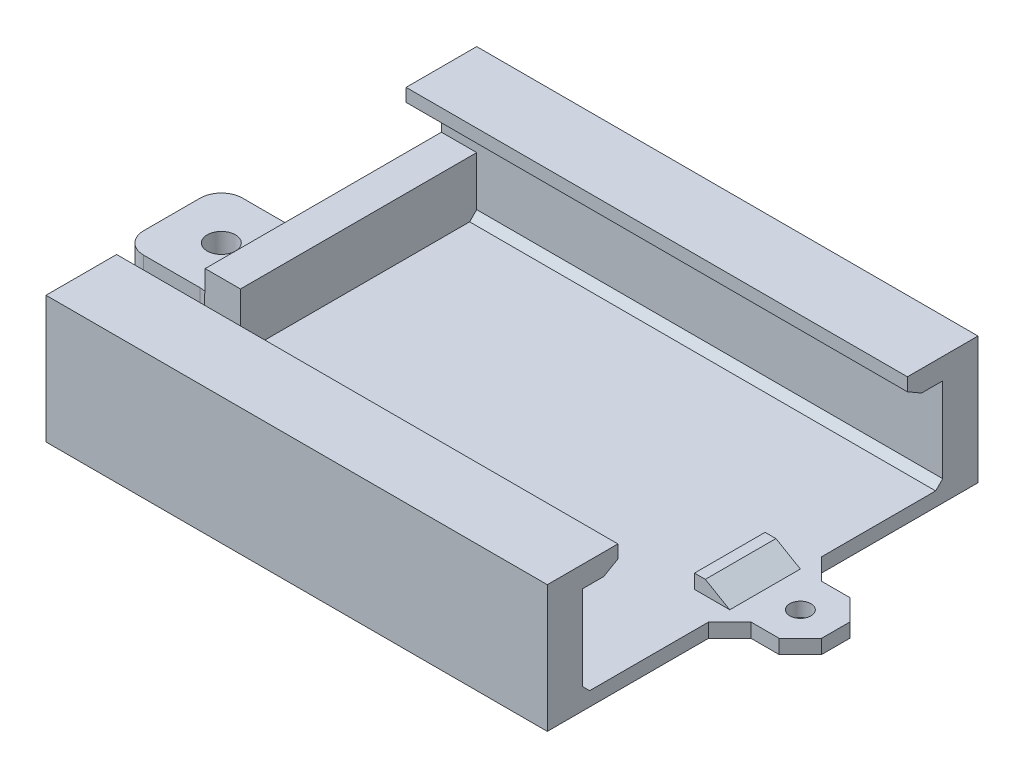
from build123d import *

# Parameters (mm, degrees)
SKETCH1_W           = 71
SKETCH1_H           = 61
SKETCH1_W_2         = 61
SKETCH1_H_2         = 51
BOSS_EXTRUDE1_DEPTH = 16
SKETCH2_W           = 71
SKETCH2_H           = 61
BOSS_EXTRUDE2_DEPTH = 2
SKETCH3_W           = 11.849749017
SKETCH3_H           = 16
CUT_EXTRUDE1_DEPTH  = 12
FILLET1_R           = 3
SKETCH4_W           = 15
SKETCH4_H           = 16
CUT_EXTRUDE2_DEPTH  = 12
SKETCH5_W           = 21
SKETCH5_H           = 8
CUT_EXTRUDE3_DEPTH  = 12
SKETCH6_W           = 51
SKETCH6_H           = 8
CUT_EXTRUDE4_DEPTH  = 12
CHAMFER1_SIZE       = 1
SKETCH8_W           = 21
SKETCH8_H           = 8
CUT_EXTRUDE5_DEPTH  = 14
SKETCH9_W           = 71
SKETCH9_H           = 3
BOSS_EXTRUDE4_DEPTH = 5
CHAMFER3_SIZE       = 2
CHAMFER3_SIZE2      = 1.154700538
SKETCH10_W          = 71
SKETCH10_H          = 3
BOSS_EXTRUDE5_DEPTH = 5
CHAMFER4_SIZE       = 2
CHAMFER4_SIZE2      = 1.154700538
SKETCH11_W          = 5
SKETCH11_H          = 10
BOSS_EXTRUDE6_DEPTH = 2
CHAMFER5_SIZE       = 2
CHAMFER5_SIZE2      = 3.464101615
SKETCH12_W          = 14
SKETCH12_H          = 5
BOSS_EXTRUDE7_DEPTH = 14
CHAMFER6_SIZE       = 2
SKETCH13_R          = 2
CUT_EXTRUDE6_DEPTH  = 14
FILLET2_R           = 3
SKETCH14_W          = 10
SKETCH14_H          = 2
BOSS_EXTRUDE8_DEPTH = 10
SKETCH15_R          = 1.5
CUT_EXTRUDE7_DEPTH  = 10
CHAMFER7_SIZE       = 3
CHAMFER8_SIZE       = 3
FILLET3_R           = 3


with BuildPart() as part:
    # Sketch1 → Boss-Extrude1 (new body)
    with BuildSketch(Plane(origin=(0, 0, 0), x_dir=(1, 0, 0), z_dir=(0, 1, 0))):
        Rectangle(SKETCH1_W, SKETCH1_H)
        Rectangle(SKETCH1_W_2, SKETCH1_H_2, mode=Mode.SUBTRACT)
    extrude(amount=BOSS_EXTRUDE1_DEPTH)

    # Sketch2 → Boss-Extrude2 (add)
    with BuildSketch(Plane.XZ):
        Rectangle(SKETCH2_W, SKETCH2_H)
    extrude(amount=BOSS_EXTRUDE2_DEPTH)

    # Sketch3 → Cut-Extrude1 (cut)
    with BuildSketch(Plane(origin=(-30.5, 0, 0), x_dir=(0, 0, -1), z_dir=(1, 0, 0))):
        with Locations((-13.884589143, 8)):
            Rectangle(SKETCH3_W, SKETCH3_H)
    extrude(amount=-CUT_EXTRUDE1_DEPTH, mode=Mode.SUBTRACT)

    # Fillet1
    fillet1_edges = [part.edges().sort_by_distance(p)[0] for p in [
        (-33, 0, 19.809463651),
        (-33, 0, 7.959714634),
    ]]
    fillet(fillet1_edges, radius=FILLET1_R)

    # Sketch4 → Cut-Extrude2 (cut)
    with BuildSketch(Plane.ZY.offset(-30.5)):
        with Locations((-18, 8)):
            Rectangle(SKETCH4_W, SKETCH4_H)
        with Locations((18, 8)):
            Rectangle(SKETCH4_W, SKETCH4_H)
    extrude(amount=-CUT_EXTRUDE2_DEPTH, mode=Mode.SUBTRACT)

    # Sketch5 → Cut-Extrude3 (cut)
    with BuildSketch(Plane.ZY.offset(-30.5)):
        with Locations((0, 12)):
            Rectangle(SKETCH5_W, SKETCH5_H)
    extrude(amount=-CUT_EXTRUDE3_DEPTH, mode=Mode.SUBTRACT)

    # Sketch6 → Cut-Extrude4 (cut)
    with BuildSketch(Plane(origin=(-30.5, 0, 0), x_dir=(0, 0, -1), z_dir=(1, 0, 0))):
        with Locations((0, 12)):
            Rectangle(SKETCH6_W, SKETCH6_H)
    extrude(amount=-CUT_EXTRUDE4_DEPTH, mode=Mode.SUBTRACT)

    # Chamfer1
    chamfer1_edges = [part.edges().sort_by_distance(p)[0] for p in [
        (2.5, 0, -25.5),
        (2.5, 0, 25.5),
    ]]
    chamfer(chamfer1_edges, length=CHAMFER1_SIZE)

    # Sketch8 → Cut-Extrude5 (cut)
    with BuildSketch(Plane.ZY.offset(-30.5)):
        with Locations((0, 4)):
            Rectangle(SKETCH8_W, SKETCH8_H)
    extrude(amount=-CUT_EXTRUDE5_DEPTH, mode=Mode.SUBTRACT)

    # Sketch9 → Boss-Extrude4 (add)
    with BuildSketch(Plane.XY.offset(-25.5)):
        with Locations((0, 14.5)):
            Rectangle(SKETCH9_W, SKETCH9_H)
    extrude(amount=BOSS_EXTRUDE4_DEPTH)

    # Chamfer3
    chamfer3_edges = [part.edges().sort_by_distance(p)[0] for p in [
        (0, 13, -20.5),
    ]]
    chamfer3_side = [part.faces().sort_by_distance(p)[0] for p in [
        (0, 13, -23),
    ]]
    chamfer(chamfer3_edges, length=CHAMFER3_SIZE, length2=CHAMFER3_SIZE2, reference=chamfer3_side[0])

    # Sketch10 → Boss-Extrude5 (add)
    with BuildSketch(Plane(origin=(0, 0, 25.5), x_dir=(-1, 0, 0), z_dir=(0, 0, -1))):
        with Locations((0, 14.5)):
            Rectangle(SKETCH10_W, SKETCH10_H)
    extrude(amount=BOSS_EXTRUDE5_DEPTH)

    # Chamfer4
    chamfer4_edges = [part.edges().sort_by_distance(p)[0] for p in [
        (0, 13, 20.5),
    ]]
    chamfer4_side = [part.faces().sort_by_distance(p)[0] for p in [
        (0, 13, 23),
    ]]
    chamfer(chamfer4_edges, length=CHAMFER4_SIZE, length2=CHAMFER4_SIZE2, reference=chamfer4_side[0])

    # Sketch11 → Boss-Extrude6 (add)
    with BuildSketch(Plane(origin=(0, 0, 0), x_dir=(1, 0, 0), z_dir=(0, 1, 0))):
        with Locations((33, 0.342687242)):
            Rectangle(SKETCH11_W, SKETCH11_H)
    extrude(amount=BOSS_EXTRUDE6_DEPTH)

    # Chamfer5
    chamfer5_edges = [part.edges().sort_by_distance(p)[0] for p in [
        (35.5, 2, -0.342687242),
    ]]
    chamfer5_side = [part.faces().sort_by_distance(p)[0] for p in [
        (35.5, 15.077350269, 21.136003145),
    ]]
    chamfer(chamfer5_edges, length=CHAMFER5_SIZE, length2=CHAMFER5_SIZE2, reference=chamfer5_side[0])

    # Sketch12 → Boss-Extrude7 (add)
    with BuildSketch(Plane.ZY.offset(35.5)):
        with Locations((-1.332725664, 0.5)):
            Rectangle(SKETCH12_W, SKETCH12_H)
    extrude(amount=BOSS_EXTRUDE7_DEPTH)

    # Chamfer6
    chamfer6_edges = [part.edges().sort_by_distance(p)[0] for p in [
        (-35.5, 3, -1.332725664),
    ]]
    chamfer(chamfer6_edges, length=CHAMFER6_SIZE)

    # Sketch13 → Cut-Extrude6 (cut)
    with BuildSketch(Plane(origin=(0, 3, 0), x_dir=(1, 0, 0), z_dir=(0, 1, 0))):
        with Locations(Location((-42.5, 1.332725664, 0), (0, 0, 270))):
            Circle(SKETCH13_R)
    extrude(amount=-CUT_EXTRUDE6_DEPTH, mode=Mode.SUBTRACT)

    # Fillet2
    fillet2_edges = [part.edges().sort_by_distance(p)[0] for p in [
        (-49.5, 0.5, -8.332725664),
        (-49.5, 0.5, 5.667274336),
    ]]
    fillet(fillet2_edges, radius=FILLET2_R)

    # Sketch14 → Boss-Extrude8 (add)
    with BuildSketch(Plane(origin=(35.5, 0, 0), x_dir=(0, 0, -1), z_dir=(1, 0, 0))):
        with Locations((0.342687242, -1)):
            Rectangle(SKETCH14_W, SKETCH14_H)
    extrude(amount=BOSS_EXTRUDE8_DEPTH)

    # Sketch15 → Cut-Extrude7 (cut)
    with BuildSketch(Plane(origin=(0, 0, 0), x_dir=(1, 0, 0), z_dir=(0, 1, 0))):
        with Locations(Location((40.5, 0.342687242, 0), (0, 0, 270))):
            Circle(SKETCH15_R)
    extrude(amount=-CUT_EXTRUDE7_DEPTH, mode=Mode.SUBTRACT)

    # Chamfer7
    chamfer7_edges = [part.edges().sort_by_distance(p)[0] for p in [
        (45.5, -1, 4.657312758),
        (45.5, -1, -5.342687242),
    ]]
    chamfer(chamfer7_edges, length=CHAMFER7_SIZE)

    # Chamfer8
    # the kernel refuses this chamfer: 3 mm, written as the material it adds along each edge
    with BuildSketch(Plane(origin=(35.5, -2, 4.657312758), x_dir=(0.9996219169112968, 0, -0.02749587661058648), z_dir=(0, 1, 0)), Plane(origin=(35.5, 0, -5.342687242), x_dir=(0.9996219169112968, 0, 0.02749587661058648), z_dir=(0, -1, 0))) as chamfer8_piece_1:
        Polygon((CHAMFER8_SIZE * 0.999621916911, -CHAMFER8_SIZE * 0.0274958766106), (-CHAMFER8_SIZE * 0.0274958766106, -CHAMFER8_SIZE * 0.999621916911), (0, 0), align=None)
    extrude(amount=2)

    # Fillet3
    # the kernel refuses this fillet: 3 mm, written as the material it adds along each edge
    with BuildSketch(Plane(origin=(-35.5, 12.5, 5.667274336), x_dir=(0, 0, 1), z_dir=(0, -1, 0))) as fillet3_piece_1_section:
        with BuildLine():
            CenterArc((FILLET3_R, FILLET3_R), FILLET3_R, 180, 90)
            Line((0, FILLET3_R), (0, 0))
            Line((0, 0), (FILLET3_R, 0))
        make_face()
    fillet3_piece_1 = extrude(amount=14.5, mode=Mode.PRIVATE)
    fillet3_piece_1 = split(fillet3_piece_1, bisect_by=Plane(origin=(-37.935900015, 2.564099985, 5.657679593), z_dir=(-0.7071067811865477, 0.7071067811865475, 0)), keep=Keep.TOP, mode=Mode.PRIVATE)
    fillet3_piece_1 = split(fillet3_piece_1, bisect_by=Plane(origin=(-38.08120002, 3, 5.657679593), z_dir=(0, -1, 0)), keep=Keep.TOP, mode=Mode.PRIVATE)
    add(fillet3_piece_1)
    with BuildSketch(Plane(origin=(-35.5, 12.5, 5.667274336), x_dir=(0, 0, 1), z_dir=(0, -1, 0))) as fillet3_piece_2_section:
        with BuildLine():
            CenterArc((FILLET3_R, FILLET3_R), FILLET3_R, 180, 90)
            Line((0, FILLET3_R), (0, 0))
            Line((0, 0), (FILLET3_R, 0))
        make_face()
    fillet3_piece_2 = extrude(amount=14.5, mode=Mode.PRIVATE)
    fillet3_piece_2 = split(fillet3_piece_2, bisect_by=Plane(origin=(-36.308682262, 4.191317738, 6.44717053), z_dir=(0.7071067811865477, -0.7071067811865475, 0)), keep=Keep.TOP, mode=Mode.PRIVATE)
    fillet3_piece_2 = split(fillet3_piece_2, bisect_by=Plane(origin=(-35.911576349, 3.794211825, 7.959714634), z_dir=(0, 0, -1)), keep=Keep.TOP, mode=Mode.PRIVATE)
    fillet3_piece_2 = split(fillet3_piece_2, bisect_by=Plane(origin=(-35.911576349, 3, 6.44717053), z_dir=(0, 1, 0)), keep=Keep.TOP, mode=Mode.PRIVATE)
    add(fillet3_piece_2)
    with BuildSketch(Plane(origin=(-35.5, 12.5, 5.667274336), x_dir=(0, 0, 1), z_dir=(0, -1, 0))) as fillet3_piece_3_section:
        with BuildLine():
            CenterArc((FILLET3_R, FILLET3_R), FILLET3_R, 180, 90)
            Line((0, FILLET3_R), (0, 0))
            Line((0, 0), (FILLET3_R, 0))
        make_face()
    fillet3_piece_3 = extrude(amount=14.5, mode=Mode.PRIVATE)
    fillet3_piece_3 = split(fillet3_piece_3, bisect_by=Plane(origin=(-38.099888212, 2.400111788, 6.295666552), z_dir=(0.7071067811865477, -0.7071067811865475, 0)), keep=Keep.TOP, mode=Mode.PRIVATE)
    fillet3_piece_3 = split(fillet3_piece_3, bisect_by=Plane(origin=(-36.191024286, 0.491247862, 7.959714634), z_dir=(0, 0, -1)), keep=Keep.TOP, mode=Mode.PRIVATE)
    fillet3_piece_3 = split(fillet3_piece_3, bisect_by=Plane(origin=(-36.191024286, 3, 6.295666552), z_dir=(0, -1, 0)), keep=Keep.TOP, mode=Mode.PRIVATE)
    add(fillet3_piece_3)
    with BuildSketch(Plane(origin=(-35.5, 12.5, 5.667274336), x_dir=(0, 0, 1), z_dir=(0, -1, 0))) as fillet3_piece_4_section:
        with BuildLine():
            CenterArc((FILLET3_R, FILLET3_R), FILLET3_R, 180, 90)
            Line((0, FILLET3_R), (0, 0))
            Line((0, 0), (FILLET3_R, 0))
        make_face()
    fillet3_piece_4 = extrude(amount=14.5, mode=Mode.PRIVATE)
    fillet3_piece_4 = split(fillet3_piece_4, bisect_by=Plane(origin=(-35.48926289, -0.06844391, 7.959714634), z_dir=(0, 0, 1)), keep=Keep.TOP, mode=Mode.PRIVATE)
    fillet3_piece_4 = fillet3_piece_4 - Plane(origin=(-35.48926289, 3, 10.959714634), x_dir=(0, -1, 0), z_dir=(-1, 0, 0)) * Cylinder(3, 41, mode=Mode.PRIVATE)
    fillet3_piece_4 = split(fillet3_piece_4, bisect_by=Plane(origin=(-35.48926289, 3, 8.232443119), z_dir=(0, -1, 0)), keep=Keep.TOP, mode=Mode.PRIVATE)
    add(fillet3_piece_4)
    with BuildSketch(Plane(origin=(-35.5, -2, -8.332725664), x_dir=(0, 0, -1), z_dir=(0, 1, 0))) as fillet3_piece_5_section:
        with BuildLine():
            CenterArc((FILLET3_R, FILLET3_R), FILLET3_R, 180, 90)
            Line((0, FILLET3_R), (0, 0))
            Line((0, 0), (FILLET3_R, 0))
        make_face()
    fillet3_piece_5 = extrude(amount=14.5, mode=Mode.PRIVATE)
    fillet3_piece_5 = split(fillet3_piece_5, bisect_by=Plane(origin=(-38.090184906, 2.409815094, -9.014565132), z_dir=(0.7071067811865477, -0.7071067811865475, 0)), keep=Keep.TOP, mode=Mode.PRIVATE)
    fillet3_piece_5 = split(fillet3_piece_5, bisect_by=Plane(origin=(-36.171856175, 3, -9.014565132), z_dir=(0, -1, 0)), keep=Keep.TOP, mode=Mode.PRIVATE)
    add(fillet3_piece_5)
    with BuildSketch(Plane(origin=(-35.5, -2, -8.332725664), x_dir=(0, 0, -1), z_dir=(0, 1, 0))) as fillet3_piece_6_section:
        with BuildLine():
            CenterArc((FILLET3_R, FILLET3_R), FILLET3_R, 180, 90)
            Line((0, FILLET3_R), (0, 0))
            Line((0, 0), (FILLET3_R, 0))
        make_face()
    fillet3_piece_6 = extrude(amount=14.5, mode=Mode.PRIVATE)
    fillet3_piece_6 = split(fillet3_piece_6, bisect_by=Plane(origin=(-37.935900015, 2.564099985, -8.32313092), z_dir=(-0.7071067811865477, 0.7071067811865475, 0)), keep=Keep.TOP, mode=Mode.PRIVATE)
    fillet3_piece_6 = split(fillet3_piece_6, bisect_by=Plane(origin=(-38.08120002, 3, -8.32313092), z_dir=(0, -1, 0)), keep=Keep.TOP, mode=Mode.PRIVATE)
    add(fillet3_piece_6)
    with BuildSketch(Plane(origin=(-35.5, -2, -8.332725664), x_dir=(0, 0, -1), z_dir=(0, 1, 0))) as fillet3_piece_7_section:
        with BuildLine():
            CenterArc((FILLET3_R, FILLET3_R), FILLET3_R, 180, 90)
            Line((0, FILLET3_R), (0, 0))
            Line((0, 0), (FILLET3_R, 0))
        make_face()
    fillet3_piece_7 = extrude(amount=14.5, mode=Mode.PRIVATE)
    fillet3_piece_7 = split(fillet3_piece_7, bisect_by=Plane(origin=(-36.295704825, 4.204295175, -9.186455327), z_dir=(0.7071067811865477, -0.7071067811865475, 0)), keep=Keep.TOP, mode=Mode.PRIVATE)
    fillet3_piece_7 = split(fillet3_piece_7, bisect_by=Plane(origin=(-35.8942731, 3, -9.186455327), z_dir=(0, 1, 0)), keep=Keep.TOP, mode=Mode.PRIVATE)
    add(fillet3_piece_7)


solid = part.part
